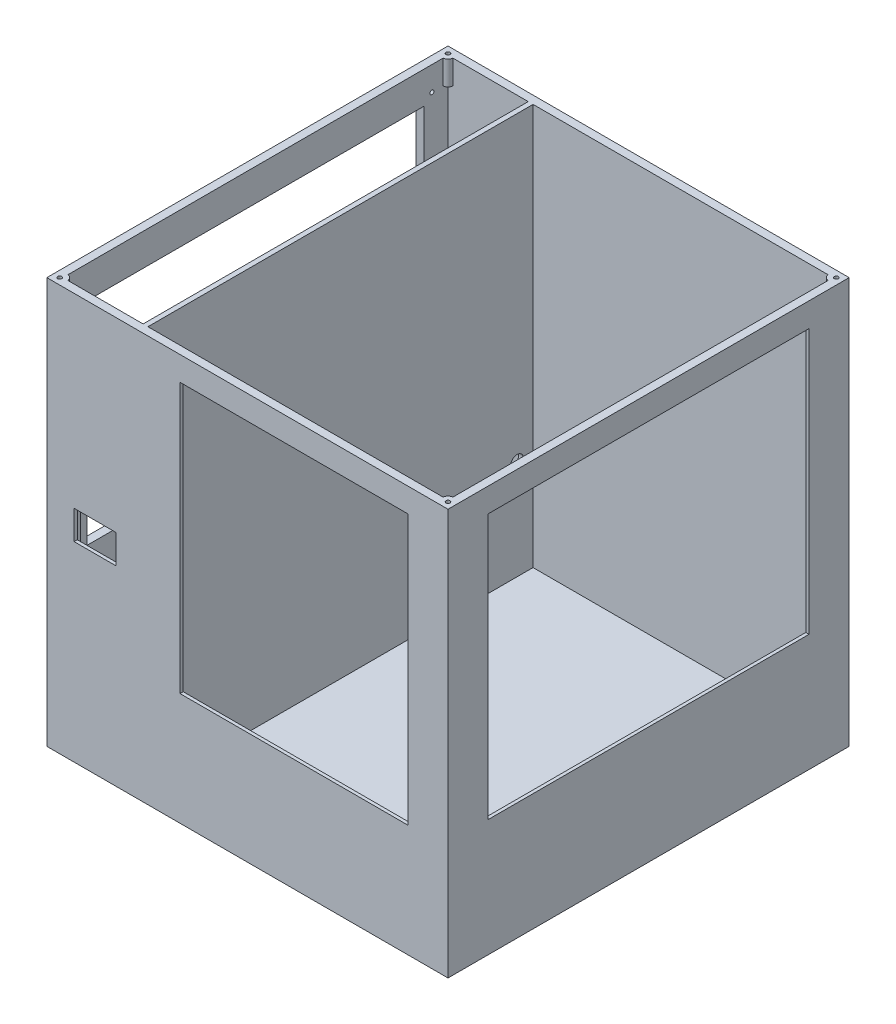
from build123d import *

# Parameters (mm, degrees)
SKETCH_1_W           = 250
SKETCH_1_H           = 250
EXTRUDE_1_DEPTH      = 3
SKETCH_2_W           = 250
SKETCH_2_H           = 250
SKETCH_2_W_2         = 240
SKETCH_2_H_2         = 240
EXTRUDE_2_DEPTH      = 250
SKETCH_3_W           = 3
SKETCH_3_H           = 240
EXTRUDE_3_DEPTH      = 250
SKETCH_8_W           = 200
SKETCH_8_H           = 165
CUT_EXTRUDE_4_DEPTH  = 8
SKETCH_9_W           = 220
SKETCH_9_H           = 185
CUT_EXTRUDE_5_DEPTH  = 3
SKETCH_11_W          = 142
SKETCH_11_H          = 168
CUT_EXTRUDE_6_DEPTH  = 10
SKETCH_12_W          = 162
SKETCH_12_H          = 188
CUT_EXTRUDE_7_DEPTH  = 3
SKETCH_16_W          = 26
SKETCH_16_H          = 18
CUT_EXTRUDE_10_DEPTH = 5
SKETCH_17_W          = 9
SKETCH_17_H          = 11
SKETCH_17_W_2        = 15
SKETCH_17_H_2        = 8
CUT_EXTRUDE_11_DEPTH = 10
SKETCH_21_W          = 28
SKETCH_21_H          = 28
CUT_EXTRUDE_14_DEPTH = 3
SKETCH_22_W          = 50
SKETCH_22_H          = 3
EXTRUDE_4_DEPTH      = 240
SKETCH_24_R          = 4
CUT_EXTRUDE_15_DEPTH = 10
SKETCH_25_W          = 210
SKETCH_25_H          = 132
CUT_EXTRUDE_16_DEPTH = 10
SKETCH_26_R          = 1.25
CUT_EXTRUDE_17_DEPTH = 10
SKETCH_27_R          = 5
CUT_EXTRUDE_18_DEPTH = 10
SKETCH_29_W          = 35
SKETCH_29_H          = 70
CUT_EXTRUDE_19_DEPTH = 10
SKETCH_30_R          = 1.25
CUT_EXTRUDE_20_DEPTH = 3
SKETCH_31_W          = 3
SKETCH_31_H          = 15
EXTRUDE_5_DEPTH      = 3
SKETCH_32_W          = 3
SKETCH_32_H          = 15
EXTRUDE_6_DEPTH      = 3
SKETCH_33_R          = 1.25
CUT_EXTRUDE_21_DEPTH = 7
FILLET_1_R           = 3


with BuildPart() as part:
    # Эскиз1 → Бобышка-Вытянуть1 (new body)
    with BuildSketch(Plane(origin=(0, 0, 0), x_dir=(1, 0, 0), z_dir=(0, 1, 0))):
        Rectangle(SKETCH_1_W, SKETCH_1_H)
    extrude(amount=EXTRUDE_1_DEPTH)

    # Эскиз2 → Бобышка-Вытянуть2 (add)
    with BuildSketch(Plane(origin=(0, 3, 0), x_dir=(1, 0, 0), z_dir=(0, 1, 0))):
        Rectangle(SKETCH_2_W, SKETCH_2_H)
        Rectangle(SKETCH_2_W_2, SKETCH_2_H_2, mode=Mode.SUBTRACT)
    extrude(amount=EXTRUDE_2_DEPTH)

    # Эскиз3 → Бобышка-Вытянуть3 (add)
    with BuildSketch(Plane(origin=(0, 3, 0), x_dir=(1, 0, 0), z_dir=(0, 1, 0))):
        with Locations((-68.5, 0)):
            Rectangle(SKETCH_3_W, SKETCH_3_H)
    extrude(amount=EXTRUDE_3_DEPTH)

    # Эскиз8 → Вырез-Вытянуть4 (cut)
    with BuildSketch(Plane(origin=(125, 0, 0), x_dir=(0, 0, -1), z_dir=(1, 0, 0))):
        with Locations((0, 155.5)):
            Rectangle(SKETCH_8_W, SKETCH_8_H)
    extrude(amount=-CUT_EXTRUDE_4_DEPTH, mode=Mode.SUBTRACT)

    # Эскиз9 → Вырез-Вытянуть5 (cut)
    with BuildSketch(Plane.ZY.offset(-120)):
        with Locations((0, 155.5)):
            Rectangle(SKETCH_9_W, SKETCH_9_H)
    extrude(amount=-CUT_EXTRUDE_5_DEPTH, mode=Mode.SUBTRACT)

    # Эскиз11 → Вырез-Вытянуть6 (cut)
    with BuildSketch(Plane.XY.offset(125)):
        with Locations((29, 154)):
            Rectangle(SKETCH_11_W, SKETCH_11_H)
    extrude(amount=-CUT_EXTRUDE_6_DEPTH, mode=Mode.SUBTRACT)

    # Эскиз12 → Вырез-Вытянуть7 (cut)
    with BuildSketch(Plane(origin=(0, 0, 120), x_dir=(-1, 0, 0), z_dir=(0, 0, -1))):
        with Locations((-29, 154)):
            Rectangle(SKETCH_12_W, SKETCH_12_H)
    extrude(amount=-CUT_EXTRUDE_7_DEPTH, mode=Mode.SUBTRACT)

    # Эскиз16 → Вырез-Вытянуть10 (cut)
    with BuildSketch(Plane.XY.offset(125)):
        with Locations((-95, 128)):
            Rectangle(SKETCH_16_W, SKETCH_16_H)
    extrude(amount=-CUT_EXTRUDE_10_DEPTH, mode=Mode.SUBTRACT)

    # Эскиз17 → Вырез-Вытянуть11 (cut)
    with BuildSketch(Plane.ZY.offset(125)):
        with Locations((105.5, 80.5)):
            Rectangle(SKETCH_17_W, SKETCH_17_H)
        with Locations((73.5, 79)):
            Rectangle(SKETCH_17_W_2, SKETCH_17_H_2)
    extrude(amount=-CUT_EXTRUDE_11_DEPTH, mode=Mode.SUBTRACT)

    # Эскиз21 → Вырез-Вытянуть14 (cut)
    with BuildSketch(Plane(origin=(0, 0, 120), x_dir=(-1, 0, 0), z_dir=(0, 0, -1))):
        with Locations((95, 128)):
            Rectangle(SKETCH_21_W, SKETCH_21_H)
    extrude(amount=-CUT_EXTRUDE_14_DEPTH, mode=Mode.SUBTRACT)

    # Эскиз22 → Бобышка-Вытянуть4 (add)
    with BuildSketch(Plane.XY.offset(-120)):
        with Locations((-95, 71.5)):
            Rectangle(SKETCH_22_W, SKETCH_22_H)
    extrude(amount=EXTRUDE_4_DEPTH)

    # Эскиз24 → Вырез-Вытянуть15 (cut)
    with BuildSketch(Plane(origin=(-67, 0, 0), x_dir=(0, 0, -1), z_dir=(1, 0, 0))):
        with Locations((110, 65)):
            Circle(SKETCH_24_R)
    extrude(amount=-CUT_EXTRUDE_15_DEPTH, mode=Mode.SUBTRACT)

    # Эскиз25 → Вырез-Вытянуть16 (cut)
    with BuildSketch(Plane.ZY.offset(125)):
        with Locations((0, 167)):
            Rectangle(SKETCH_25_W, SKETCH_25_H)
    extrude(amount=-CUT_EXTRUDE_16_DEPTH, mode=Mode.SUBTRACT)

    # Эскиз26 → Вырез-Вытянуть17 (cut)
    with BuildSketch(Plane.ZY.offset(125)):
        with Locations((-110, 238)):
            Circle(SKETCH_26_R)
        with Locations((110, 238)):
            Circle(SKETCH_26_R)
        with Locations((110, 96)):
            Circle(SKETCH_26_R)
        with Locations((-110, 96)):
            Circle(SKETCH_26_R)
    extrude(amount=-CUT_EXTRUDE_17_DEPTH, mode=Mode.SUBTRACT)

    # Эскиз27 → Вырез-Вытянуть18 (cut)
    with BuildSketch(Plane(origin=(0, 73, 0), x_dir=(1, 0, 0), z_dir=(0, 1, 0))):
        with Locations(Location((-95, 10, 0), (0, 0, 270))):
            Circle(SKETCH_27_R)
    extrude(amount=-CUT_EXTRUDE_18_DEPTH, mode=Mode.SUBTRACT)

    # Эскиз29 → Вырез-Вытянуть19 (cut)
    with BuildSketch(Plane(origin=(0, 73, 0), x_dir=(1, 0, 0), z_dir=(0, 1, 0))):
        with Locations((-95, 65)):
            Rectangle(SKETCH_29_W, SKETCH_29_H)
    extrude(amount=-CUT_EXTRUDE_19_DEPTH, mode=Mode.SUBTRACT)

    # Эскиз30 → Вырез-Вытянуть20 (cut)
    with BuildSketch(Plane(origin=(0, 73, 0), x_dir=(1, 0, 0), z_dir=(0, 1, 0))):
        with Locations(Location((-75, 105, 0), (0, 0, 270))):
            Circle(SKETCH_30_R)
        with Locations(Location((-115, 105, 0), (0, 0, 270))):
            Circle(SKETCH_30_R)
        with Locations(Location((-115, 25, 0), (0, 0, 270))):
            Circle(SKETCH_30_R)
        with Locations(Location((-75, 25, 0), (0, 0, 270))):
            Circle(SKETCH_30_R)
    extrude(amount=-CUT_EXTRUDE_20_DEPTH, mode=Mode.SUBTRACT)

    # Эскиз31 → Бобышка-Вытянуть5 (add)
    with BuildSketch(Plane.XY.offset(-120)):
        with Locations((118.5, 245.5)):
            Rectangle(SKETCH_31_W, SKETCH_31_H)
        with Locations((-118.5, 245.5)):
            Rectangle(SKETCH_31_W, SKETCH_31_H)
    extrude(amount=EXTRUDE_5_DEPTH)

    # Эскиз32 → Бобышка-Вытянуть6 (add)
    with BuildSketch(Plane(origin=(0, 0, 120), x_dir=(-1, 0, 0), z_dir=(0, 0, -1))):
        with Locations((-118.5, 245.5)):
            Rectangle(SKETCH_32_W, SKETCH_32_H)
        with Locations((118.5, 245.5)):
            Rectangle(SKETCH_32_W, SKETCH_32_H)
    extrude(amount=EXTRUDE_6_DEPTH)

    # Эскиз33 → Вырез-Вытянуть21 (cut)
    with BuildSketch(Plane(origin=(0, 253, 0), x_dir=(1, 0, 0), z_dir=(0, 1, 0))):
        with Locations(Location((-121, -121, 0), (0, 0, 270))):
            Circle(SKETCH_33_R)
        with Locations(Location((-121, 121, 0), (0, 0, 270))):
            Circle(SKETCH_33_R)
        with Locations(Location((121, 121, 0), (0, 0, 270))):
            Circle(SKETCH_33_R)
        with Locations(Location((121, -121, 0), (0, 0, 270))):
            Circle(SKETCH_33_R)
    extrude(amount=-CUT_EXTRUDE_21_DEPTH, mode=Mode.SUBTRACT)

    # Скругление1
    fillet_1_edges = [part.edges().sort_by_distance(p)[0] for p in [
        (117, 245.5, -117),
        (-117, 245.5, -117),
        (117, 245.5, 117),
        (-117, 245.5, 117),
    ]]
    fillet(fillet_1_edges, radius=FILLET_1_R - 0.0001)  # a hair under: the kernel refuses the full size


solid = part.part
